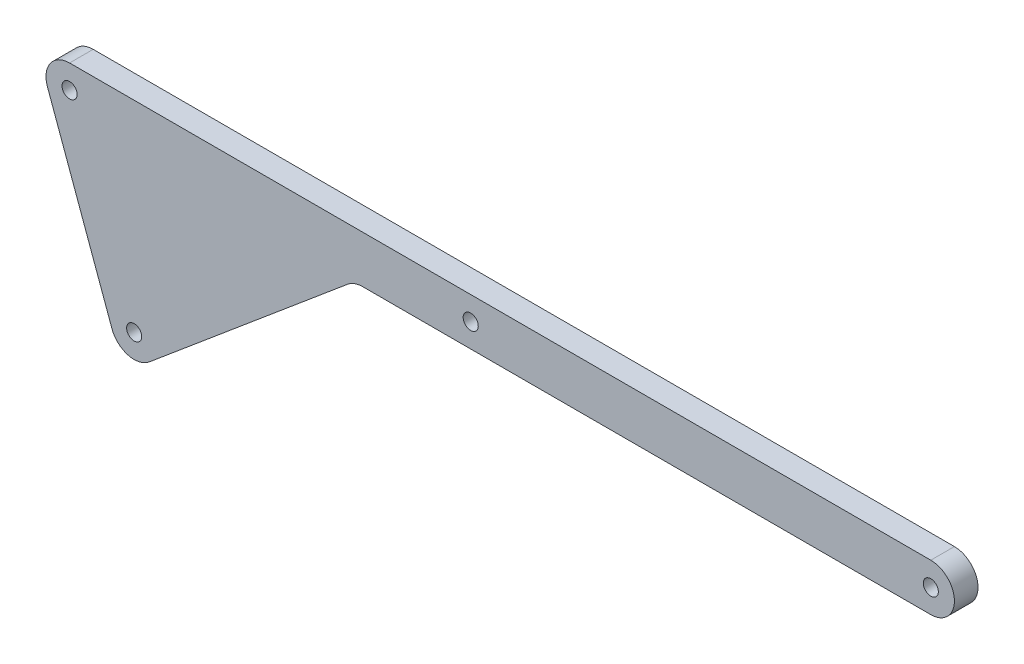
from build123d import *

# Parameters (mm, degrees)
SKETCH2_R           = 2.032
BOSS_EXTRUDE1_DEPTH = 3.175


with BuildPart() as part:
    # Sketch2 → Boss-Extrude1 (new, symmetric)
    with BuildSketch(Plane.XY):
        with BuildLine():
            Line((0, 6.35), (231.775, 6.35))
            ThreePointArc((231.775, 6.35), (238.125, 0), (231.775, -6.35))
            Line((231.775, -6.35), (78.887053739, -6.35))
            ThreePointArc((78.887053739, -6.35), (76.715225829, -6.732951858), (74.805352418, -7.835617786))
            Line((74.805352418, -7.835617786), (21.456324602, -52.60076735))
            ThreePointArc((21.456324602, -52.60076735), (15.731122345, -53.870014133), (11.407575139, -49.908213046))
            Line((11.407575139, -49.908213046), (-5.967048142, -2.17182791))
            ThreePointArc((-5.967048142, -2.17182791), (-5.201615481, 3.642210371), (0, 6.35))
        make_face()
        Circle(SKETCH2_R, mode=Mode.SUBTRACT)
        with Locations((231.775, 0)):
            Circle(SKETCH2_R, mode=Mode.SUBTRACT)
        with Locations((107.95, 0)):
            Circle(SKETCH2_R, mode=Mode.SUBTRACT)
        with Locations((17.374623281, -47.736385136)):
            Circle(SKETCH2_R, mode=Mode.SUBTRACT)
    extrude(amount=BOSS_EXTRUDE1_DEPTH, both=True)


solid = part.part
